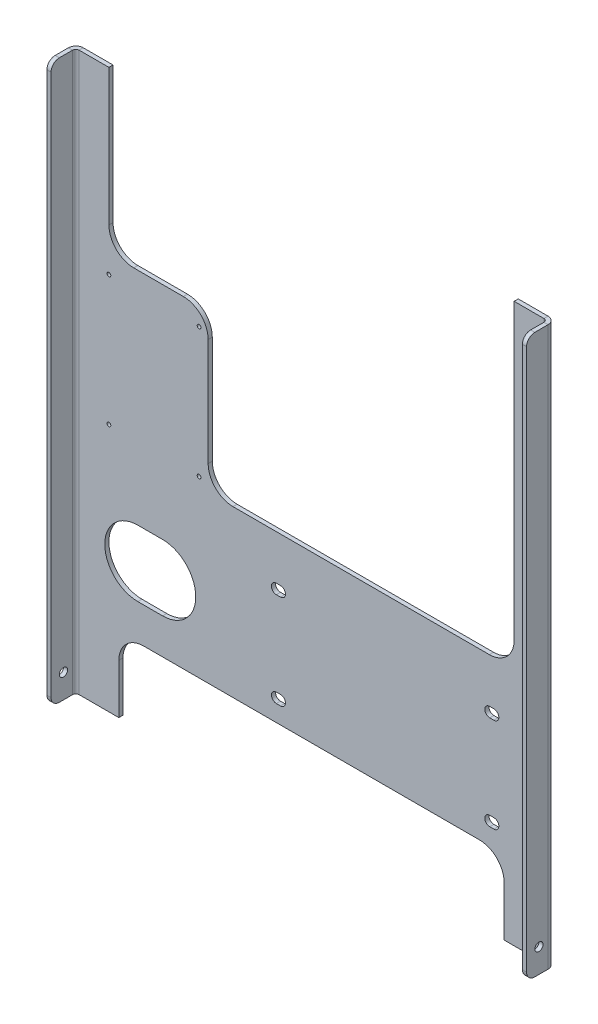
from build123d import *

# Parameters (mm, degrees)
SKETCH_1_R                         = 2.25
SM_BASE_FLANGE_1_DEPTH             = 5
FILLET_1_R                         = 30
SM_EDGE_FLANGE_1_STRIP_W           = 28
SM_EDGE_FLANGE_1_STRIP_H           = 5
SM_EDGE_FLANGE_1_STRIP_CUT_DEPTH   = 675
SM_EDGE_FLANGE_1_STRIP_2_W         = 28
SM_EDGE_FLANGE_1_STRIP_2_H         = 5
SM_EDGE_FLANGE_1_STRIP_CUT_2_DEPTH = 675
SM_EDGE_FLANGE_1_DEPTH             = 675
SM_EDGE_FLANGE_1_BEND_DEPTH        = 675
CUT_EXTRUDE_3_REACH                = 892.463
FILLET_2_R                         = 10
SKETCH_12_R                        = 5
CUT_EXTRUDE_4_DEPTH                = 891.463362525


# Sheet-metal steps are written as plain solids
with BuildPart() as part:
    # Sketch 1 → 基体-法兰1 (new body)
    with BuildSketch(Plane.XY):
        Polygon((0, 0), (0, 675), (45, 675), (45, 480), (165, 480), (165, 290), (535, 290), (535, 675), (580, 675), (580, 0), (523, 0), (523, 90), (57, 90), (57, 0), align=None)
        with Locations((154, 458)):
            Circle(SKETCH_1_R, mode=Mode.SUBTRACT)
        with Locations((45, 458)):
            Circle(SKETCH_1_R, mode=Mode.SUBTRACT)
        with Locations((154, 301)):
            Circle(SKETCH_1_R, mode=Mode.SUBTRACT)
        with Locations((45, 301)):
            Circle(SKETCH_1_R, mode=Mode.SUBTRACT)
        with BuildLine():
            Line((80, 133), (110, 133))
            ThreePointArc((110, 133), (150, 173), (110, 213))
            Line((110, 213), (80, 213))
            ThreePointArc((80, 213), (40, 173), (80, 133))
        make_face(mode=Mode.SUBTRACT)
    extrude(amount=-SM_BASE_FLANGE_1_DEPTH)

    # 圆角1
    fillet_1_edges = [part.edges().sort_by_distance(p)[0] for p in [
        (45, 480, -2.5),
        (165, 480, -2.5),
        (165, 290, -2.5),
        (535, 290, -2.5),
        (523, 90, -2.5),
        (57, 90, -2.5),
    ]]
    fillet(fillet_1_edges, radius=FILLET_1_R)

    # 边线-法兰1 strip (across the edge) → 边线-法兰1 strip cut (cut)
    with BuildSketch(Plane.XZ.offset(-675)):
        with Locations((-5, -2.5)):
            Rectangle(SM_EDGE_FLANGE_1_STRIP_W, SM_EDGE_FLANGE_1_STRIP_H)
    extrude(amount=SM_EDGE_FLANGE_1_STRIP_CUT_DEPTH, mode=Mode.SUBTRACT)

    # 边线-法兰1 strip 2 (across the edge) → 边线-法兰1 strip cut 2 (cut)
    with BuildSketch(Plane(origin=(580, 0, 0), x_dir=(-1, 0, 0), z_dir=(0, 1, 0))):
        with Locations((-5, -2.5)):
            Rectangle(SM_EDGE_FLANGE_1_STRIP_2_W, SM_EDGE_FLANGE_1_STRIP_2_H)
    extrude(amount=SM_EDGE_FLANGE_1_STRIP_CUT_2_DEPTH, mode=Mode.SUBTRACT)

    # 边线-法兰1 section (across the edge) → 边线-法兰1 (add)
    with BuildSketch(Plane.XZ.offset(-675)):
        with BuildLine():
            Line((0, 4), (0, 30))
            Line((0, 30), (5, 30))
            Line((5, 30), (5, 4))
            ThreePointArc((5, 4), (6.171572875, 1.171572875), (9, 0))
            Line((9, 0), (9, -5))
            ThreePointArc((9, -5), (2.636038969, -2.363961031), (0, 4))
        make_face()
    extrude(amount=SM_EDGE_FLANGE_1_DEPTH)

    # 边线-法兰1 section 2 (across the edge) → 边线-法兰1 bend (add)
    with BuildSketch(Plane(origin=(580, 0, 0), x_dir=(-1, 0, 0), z_dir=(0, 1, 0))):
        with BuildLine():
            Line((0, 4), (0, 30))
            Line((0, 30), (5, 30))
            Line((5, 30), (5, 4))
            ThreePointArc((5, 4), (6.171572875, 1.171572875), (9, 0))
            Line((9, 0), (9, -5))
            ThreePointArc((9, -5), (2.636038969, -2.363961031), (0, 4))
        make_face()
    extrude(amount=SM_EDGE_FLANGE_1_BEND_DEPTH)

    # 草图11 → 切除-拉伸3 (cut, up to next)
    with BuildSketch(Plane.XY, mode=Mode.PRIVATE) as cut_extrude_3_sk1:
        with BuildLine():
            Line((252.5, 110), (247.5, 110))
            ThreePointArc((247.5, 110), (241.5, 116), (247.5, 122))
            Line((247.5, 122), (252.5, 122))
            ThreePointArc((252.5, 122), (258.5, 116), (252.5, 110))
        make_face()
    cut_extrude_3_tool1 = extrude(cut_extrude_3_sk1.sketch, amount=-CUT_EXTRUDE_3_REACH, mode=Mode.PRIVATE) & part.part
    # 草图11 → 切除-拉伸3 (cut, up to next)
    with BuildSketch(Plane.XY, mode=Mode.PRIVATE) as cut_extrude_3_sk2:
        with BuildLine():
            Line((510.5, 110), (505.5, 110))
            ThreePointArc((505.5, 110), (499.5, 116), (505.5, 122))
            Line((505.5, 122), (510.5, 122))
            ThreePointArc((510.5, 122), (516.5, 116), (510.5, 110))
        make_face()
    cut_extrude_3_tool2 = extrude(cut_extrude_3_sk2.sketch, amount=-CUT_EXTRUDE_3_REACH, mode=Mode.PRIVATE) & part.part
    # 草图11 → 切除-拉伸3 (cut, up to next)
    with BuildSketch(Plane.XY, mode=Mode.PRIVATE) as cut_extrude_3_sk3:
        with BuildLine():
            Line((510.5, 224), (505.5, 224))
            ThreePointArc((505.5, 224), (499.5, 230), (505.5, 236))
            Line((505.5, 236), (510.5, 236))
            ThreePointArc((510.5, 236), (516.5, 230), (510.5, 224))
        make_face()
    cut_extrude_3_tool3 = extrude(cut_extrude_3_sk3.sketch, amount=-CUT_EXTRUDE_3_REACH, mode=Mode.PRIVATE) & part.part
    # 草图11 → 切除-拉伸3 (cut, up to next)
    with BuildSketch(Plane.XY, mode=Mode.PRIVATE) as cut_extrude_3_sk4:
        with BuildLine():
            Line((252.5, 224), (247.5, 224))
            ThreePointArc((247.5, 224), (241.5, 230), (247.5, 236))
            Line((247.5, 236), (252.5, 236))
            ThreePointArc((252.5, 236), (258.5, 230), (252.5, 224))
        make_face()
    cut_extrude_3_tool4 = extrude(cut_extrude_3_sk4.sketch, amount=-CUT_EXTRUDE_3_REACH, mode=Mode.PRIVATE) & part.part
    add(cut_extrude_3_tool1.solids().sort_by_distance((250, 116, 0))[0], mode=Mode.SUBTRACT)
    add(cut_extrude_3_tool2.solids().sort_by_distance((508, 116, 0))[0], mode=Mode.SUBTRACT)
    add(cut_extrude_3_tool3.solids().sort_by_distance((508, 230, 0))[0], mode=Mode.SUBTRACT)
    add(cut_extrude_3_tool4.solids().sort_by_distance((250, 230, 0))[0], mode=Mode.SUBTRACT)

    # 圆角2
    fillet_2_edges = [part.edges().sort_by_distance(p)[0] for p in [
        (2.5, 675, 30),
        (2.5, 0, 30),
        (577.5, 0, 30),
        (577.5, 675, 30),
    ]]
    fillet(fillet_2_edges, radius=FILLET_2_R)

    # 草图12 → 切除-拉伸4 (cut, through all)
    with BuildSketch(Plane(origin=(580, 0, 0), x_dir=(0, 0, -1), z_dir=(1, 0, 0))):
        with Locations((-15, 29)):
            Circle(SKETCH_12_R)
    extrude(amount=-CUT_EXTRUDE_4_DEPTH, mode=Mode.SUBTRACT)


solid = part.part
